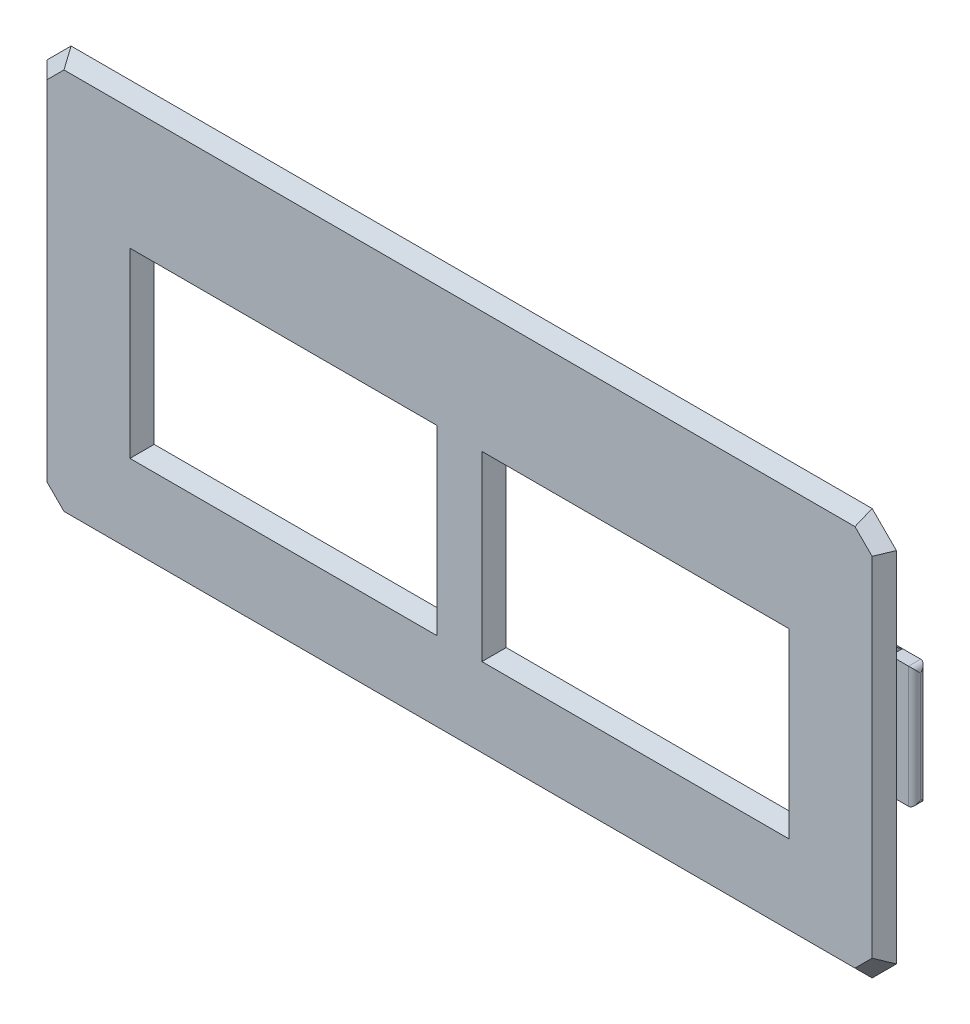
from build123d import *

# Parameters (mm, degrees)
BOSS_EXTRUDE1_DEPTH      = 1
SKETCH2_W                = 23.3
SKETCH2_H                = 13
CUT_EXTRUDE1_DEPTH       = 3
CHAMFER1_SIZE            = 1
CHAMFER1_OF_MIRROR1_SIZE = 1
CHAMFER2_SIZE            = 1
SKETCH3_W                = 2
SKETCH3_H                = 10
BOSS_EXTRUDE2_DEPTH      = 3
SKETCH4_W                = 1
SKETCH4_H                = 10
BOSS_EXTRUDE3_DEPTH      = 2
FILLET1_R                = 0.5
FILLET1_OF_MIRROR2_R     = 0.5


with BuildPart() as part:
    # Sketch1 → Boss-Extrude1 (new body)
    with BuildSketch(Plane.XY):
        Polygon((-35, 14.75), (-35, -14.75), (-33, -16.75), (33, -16.75), (35, -14.75), (35, 14.75), (33, 16.75), (-33, 16.75), align=None)
    extrude(amount=BOSS_EXTRUDE1_DEPTH)

    # Sketch2 → Cut-Extrude1 (cut)
    with BuildSketch(Plane.XY.offset(1)):
        with Locations((-14.5, -1.75)):
            Rectangle(SKETCH2_W, SKETCH2_H)
    cut_extrude1 = extrude(amount=-CUT_EXTRUDE1_DEPTH, mode=Mode.SUBTRACT)

    # Chamfer1
    chamfer1_edges = [part.edges().sort_by_distance(p)[0] for p in [
        (-14.5, -8.25, 1),
        (-2.85, -1.75, 1),
        (-14.5, 4.75, 1),
        (-26.15, -1.75, 1),
    ]]
    chamfer(chamfer1_edges, length=CHAMFER1_SIZE - 0.0001)  # a hair under: the kernel refuses the full size

    # Mirror1: Cut-Extrude1 across plane
    add(cut_extrude1.mirror(Plane(origin=(0, 0, 0), x_dir=(0, 0, 1), z_dir=(1, 0, 0))), mode=Mode.SUBTRACT)

    # Chamfer1 of Mirror1
    chamfer1_of_mirror1_edges = [part.edges().sort_by_distance(p)[0] for p in [
        (14.5, -8.25, 1),
        (2.85, -1.75, 1),
        (14.5, 4.75, 1),
        (26.15, -1.75, 1),
    ]]
    chamfer(chamfer1_of_mirror1_edges, length=CHAMFER1_OF_MIRROR1_SIZE - 0.0001)  # a hair under: the kernel refuses the full size

    # Chamfer2
    chamfer2_edges = [part.edges().sort_by_distance(p)[0] for p in [
        (35, 0, 1),
        (34, 15.75, 1),
        (0, 16.75, 1),
        (-34, 15.75, 1),
        (-35, 0, 1),
        (34, -15.75, 1),
        (0, -16.75, 1),
        (-34, -15.75, 1),
    ]]
    chamfer(chamfer2_edges, length=CHAMFER2_SIZE - 0.0001)  # a hair under: the kernel refuses the full size

    # Sketch3 → Boss-Extrude2 (add)
    with BuildSketch(Plane(origin=(0, 0, 0), x_dir=(-1, 0, 0), z_dir=(0, 0, -1))):
        with Locations((-31.5, 0)):
            Rectangle(SKETCH3_W, SKETCH3_H)
    boss_extrude2 = extrude(amount=BOSS_EXTRUDE2_DEPTH)

    # Sketch4 → Boss-Extrude3 (add)
    with BuildSketch(Plane(origin=(32.5, 0, 0), x_dir=(0, 0, -1), z_dir=(1, 0, 0))):
        with Locations((2.5, 0)):
            Rectangle(SKETCH4_W, SKETCH4_H)
    boss_extrude3 = extrude(amount=BOSS_EXTRUDE3_DEPTH)

    # Fillet1
    fillet1_edges = [part.edges().sort_by_distance(p)[0] for p in [
        (34.5, 0, -3),
        (34.5, 5, -2.5),
        (34.5, 0, -2),
        (34.5, -5, -2.5),
    ]]
    fillet(fillet1_edges, radius=FILLET1_R - 0.0001)  # a hair under: the kernel refuses the full size

    # Mirror2: Boss-Extrude2, Boss-Extrude3 across plane
    add(boss_extrude2.mirror(Plane(origin=(0, 0, 0), x_dir=(0, 0, 1), z_dir=(1, 0, 0))))
    add(boss_extrude3.mirror(Plane(origin=(0, 0, 0), x_dir=(0, 0, 1), z_dir=(1, 0, 0))))

    # Fillet1 of Mirror2
    fillet1_of_mirror2_edges = [part.edges().sort_by_distance(p)[0] for p in [
        (-34.5, 0, -3),
        (-34.5, 5, -2.5),
        (-34.5, 0, -2),
        (-34.5, -5, -2.5),
    ]]
    fillet(fillet1_of_mirror2_edges, radius=FILLET1_OF_MIRROR2_R - 0.0001)  # a hair under: the kernel refuses the full size

    # Chamfer3: read off the stored shape, not the designer's step
    # Chamfer3: loft between two sections, ruled curve by curve
    chamfer3_from = [
        Edge.make_line((32.5, -5, -3), (30.5, -5, -3)),
        Edge.make_line((30.5, -5, -3), (30.5, 5, -3)),
        Edge.make_line((30.5, 5, -3), (32.5, 5, -3)),
        Edge.make_line((32.5, 5, -3), (32.5, -5, -3)),
    ]
    chamfer3_to = [
        Edge.make_line((32.5, -7, 0), (28.5, -7, 0)),
        Edge.make_line((28.5, -7, 0), (28.5, 7, 0)),
        Edge.make_line((28.5, 7, 0), (32.5, 7, 0)),
        Edge.make_line((32.5, 7, 0), (32.5, -7, 0)),
    ]
    chamfer3 = Solid(Shell([*[Face.make_surface_from_curves(chamfer3_from[k], chamfer3_to[k]) for k in range(4)], Face(Wire(chamfer3_from)), Face(Wire(chamfer3_to))]))
    add(chamfer3)

    # Chamfer4: read off the stored shape, not the designer's step
    # Chamfer4: loft between two sections, ruled curve by curve
    chamfer4_from = [
        Edge.make_line((-32.5, -5, -3), (-30.5, -5, -3)),
        Edge.make_line((-32.5, 5, -3), (-30.5, 5, -3)),
        Edge.make_line((-30.5, 5, -3), (-30.5, -5, -3)),
        Edge.make_line((-32.5, 5, -3), (-32.5, -5, -3)),
    ]
    chamfer4_to = [
        Edge.make_line((-32.5, -7, 0), (-28.5, -7, 0)),
        Edge.make_line((-32.5, 7, 0), (-28.5, 7, 0)),
        Edge.make_line((-28.5, 7, 0), (-28.5, -7, 0)),
        Edge.make_line((-32.5, 7, 0), (-32.5, -7, 0)),
    ]
    chamfer4 = Solid(Shell([*[Face.make_surface_from_curves(chamfer4_from[k], chamfer4_to[k]) for k in range(4)], Face(Wire(chamfer4_from)), Face(Wire(chamfer4_to))]))
    add(chamfer4)


solid = part.part
